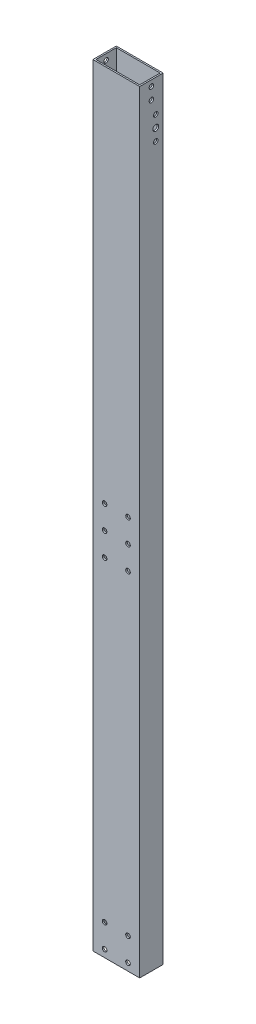
from build123d import *

# Parameters (mm, degrees)
SKETCH1_W               = 50.8
SKETCH1_H               = 838.2
BOSS_EXTRUDE1_DEPTH     = 12.7
SHELL1_T                = -1.5875
CUT_EXTRUDE1_DEPTH      = 421.061019377
CUT_EXTRUDE1_DEPTH_BACK = 421.061019377
SKETCH3_R               = 2.4892
CUT_EXTRUDE2_DEPTH      = 421.061019377
CUT_EXTRUDE2_DEPTH_BACK = 421.061019377
SKETCH4_R               = 3.175
SKETCH4_R_2             = 2.4892
SKETCH5_W               = 31.75
SKETCH5_H               = 26.9875
CUT_EXTRUDE3_DEPTH      = 421.061019377
FILLET1_R               = 3.175
SKETCH6_R               = 2.4892
CUT_EXTRUDE4_DEPTH      = 421.061019377


with BuildPart() as part:
    # Sketch1 → Boss-Extrude1 (new, symmetric)
    with BuildSketch(Plane.XY):
        Rectangle(SKETCH1_W, SKETCH1_H)
    extrude(amount=BOSS_EXTRUDE1_DEPTH, both=True)

    # Shell1
    shell1_openings = [part.faces().sort_by_distance(p)[0] for p in [
        (0, -419.1, 0),
        (0, 419.1, 0),
    ]]
    offset(amount=SHELL1_T, openings=shell1_openings, kind=Kind.INTERSECTION)

    # Sketch3 → Cut-Extrude1 (cut, two sides: drawn at the far end of the back side and taken through both)
    with BuildSketch(Plane(origin=(0, 0, 0), x_dir=(0, 0, -1), z_dir=(1, 0, 0)).offset(-CUT_EXTRUDE1_DEPTH_BACK)):
        with Locations((0, 400.05)):
            Circle(SKETCH3_R)
        with Locations((0, 412.75)):
            Circle(SKETCH3_R)
    extrude(amount=CUT_EXTRUDE1_DEPTH + CUT_EXTRUDE1_DEPTH_BACK, mode=Mode.SUBTRACT)

    # Sketch4 → Cut-Extrude2 (cut, two sides: drawn at the far end of the back side and taken through both)
    with BuildSketch(Plane(origin=(0, 0, 0), x_dir=(0, 0, -1), z_dir=(1, 0, 0)).offset(-CUT_EXTRUDE2_DEPTH_BACK)):
        with Locations((4.7625, 371.475)):
            Circle(SKETCH4_R)
        with Locations((4.7625, 384.175)):
            Circle(SKETCH4_R_2)
        with Locations((4.7625, 358.775)):
            Circle(SKETCH4_R_2)
    extrude(amount=CUT_EXTRUDE2_DEPTH + CUT_EXTRUDE2_DEPTH_BACK, mode=Mode.SUBTRACT)

    # Sketch5 → Cut-Extrude3 (cut, through all)
    with BuildSketch(Plane.XY):
        with Locations((0, 371.475)):
            Rectangle(SKETCH5_W, SKETCH5_H)
    extrude(amount=-CUT_EXTRUDE3_DEPTH, mode=Mode.SUBTRACT)

    # Fillet1
    fillet1_edges = [part.edges().sort_by_distance(p)[0] for p in [
        (15.875, 384.96875, -11.90625),
        (15.875, 357.98125, -11.90625),
        (-15.875, 357.98125, -11.90625),
        (-15.875, 384.96875, -11.90625),
    ]]
    fillet(fillet1_edges, radius=FILLET1_R)

    # Sketch6 → Cut-Extrude4 (cut, through all)
    with BuildSketch(Plane.XY):
        with Locations((-12.7, 7.9375)):
            Circle(SKETCH6_R)
        with Locations((12.7, 7.9375)):
            Circle(SKETCH6_R)
        with Locations((12.7, -17.4625)):
            Circle(SKETCH6_R)
        with Locations((12.7, -42.8625)):
            Circle(SKETCH6_R)
        with Locations((-12.7, -17.4625)):
            Circle(SKETCH6_R)
        with Locations((-12.7, -42.8625)):
            Circle(SKETCH6_R)
        with Locations((-12.7, -411.1625)):
            Circle(SKETCH6_R)
        with Locations((12.7, -411.1625)):
            Circle(SKETCH6_R)
        with Locations((12.7, -385.7625)):
            Circle(SKETCH6_R)
        with Locations((-12.7, -385.7625)):
            Circle(SKETCH6_R)
    extrude(amount=CUT_EXTRUDE4_DEPTH, mode=Mode.SUBTRACT)


solid = part.part
